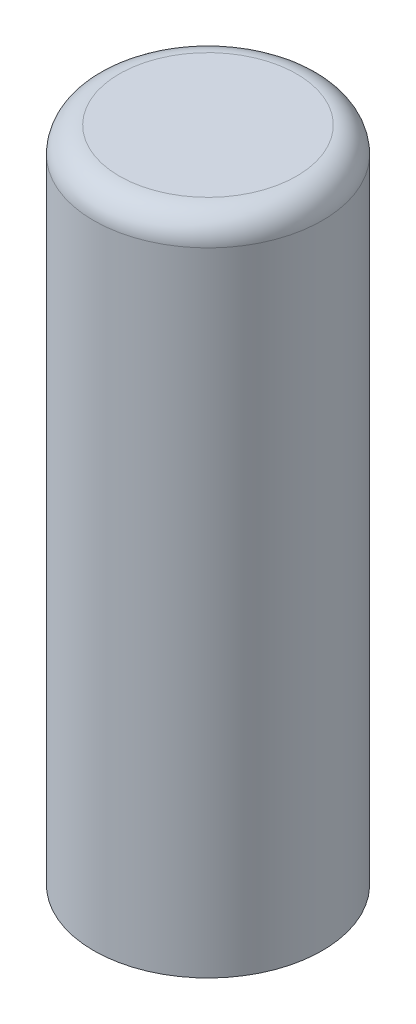
from build123d import *

# Parameters (mm, degrees)
SKETCH1_R           = 15.591175954
BOSS_EXTRUDE1_DEPTH = 71
BOSS_EXTRUDE2_START = 1.25
SKETCH2_R           = 15.591175954
SKETCH2_W           = 17.8
SKETCH2_H           = 1.65
BOSS_EXTRUDE2_DEPTH = 1.25
BOSS_EXTRUDE3_START = 4
SKETCH3_R           = 15.591175954
BOSS_EXTRUDE3_DEPTH = 4
CUT_EXTRUDE4_START  = -11.5
SKETCH16_R          = 0.75
CUT_EXTRUDE4_DEPTH  = 11.5
BOSS_EXTRUDE8_START = 10
SKETCH18_R          = 15.591175954
SKETCH18_R_2        = 13.095738675
BOSS_EXTRUDE8_DEPTH = 10
FILLET3_START       = -12.2500001
FILLET3_OUTLINE_R   = 13.095738675
FILLET3_OUTLINE_R_2 = 0.75
FILLET3_DEPTH       = 7.0000001
FILLET3_START_2     = -11
FILLET3_3_DEPTH     = 5.75
SKETCH26_R          = 15.591175954
BOSS_EXTRUDE9_DEPTH = 3.5
FILLET4_R           = 3.5


with BuildPart() as part:
    # Sketch1 → Boss-Extrude1 (new body)
    with BuildSketch(Plane(origin=(0, 0, 0), x_dir=(1, 0, 0), z_dir=(0, 1, 0))):
        with Locations(Location((0, 0, 0), (0, 0, 270))):
            Circle(SKETCH1_R)
        with BuildLine():
            Line((8.375, -6.964282891), (9.075, -6.964282891))
            Line((9.075, -6.964282891), (9.075, -8.614282891))
            Line((9.075, -8.614282891), (8.375, -8.614282891))
            Line((8.375, -8.614282891), (8.375, -9.610929808))
            ThreePointArc((8.375, -9.610929808), (0, -12.747964417), (-8.375, -9.610929808))
            Line((-8.375, -9.610929808), (-8.375, -8.614282891))
            Line((-8.375, -8.614282891), (-8.725, -8.614282891))
            Line((-8.725, -8.614282891), (-8.725, -6.964282891))
            Line((-8.725, -6.964282891), (-8.375, -6.964282891))
            Line((-8.375, -6.964282891), (-8.375, -6.204282891))
            Line((-8.375, -6.204282891), (-8.375, 9.645717109))
            ThreePointArc((-8.375, 9.645717109), (-7.386485387, 12.032202496), (-5, 13.020717109))
            Line((-5, 13.020717109), (5, 13.020717109))
            ThreePointArc((5, 13.020717109), (7.386485387, 12.032202496), (8.375, 9.645717109))
            Line((8.375, 9.645717109), (8.375, -6.204282891))
            Line((8.375, -6.204282891), (8.375, -6.964282891))
        make_face(mode=Mode.SUBTRACT)
    extrude(amount=BOSS_EXTRUDE1_DEPTH)

    # Sketch2 → Boss-Extrude2 (add)
    with BuildSketch(Plane.XZ.offset(BOSS_EXTRUDE2_START)):
        with Locations(Location((0, 0, 0), (0, 0, 270))):
            Circle(SKETCH2_R)
        with Locations((0.175, 7.789282891)):
            Rectangle(SKETCH2_W, SKETCH2_H, mode=Mode.SUBTRACT)
    extrude(amount=-BOSS_EXTRUDE2_DEPTH)

    # Sketch3 → Boss-Extrude3 (add)
    with BuildSketch(Plane.XZ.offset(1.25).offset(BOSS_EXTRUDE3_START)):
        with Locations(Location((0, 0, 0), (0, 0, 270))):
            Circle(SKETCH3_R)
    extrude(amount=-BOSS_EXTRUDE3_DEPTH)

    # Sketch16 → Cut-Extrude4 (cut)
    with BuildSketch(Plane(origin=(0, 0, 0), x_dir=(1, 0, 0), z_dir=(0, 1, 0)).offset(CUT_EXTRUDE4_START)):
        with BuildLine():
            Line((-3.75, -9.901070776), (-3, -9.901070776))
            Line((-3, -9.901070776), (-2.25, -9.901070776))
            ThreePointArc((-2.25, -9.901070776), (-3, -9.151070776), (-3.75, -9.901070776))
        make_face()
        with BuildLine():
            Line((-2.25, -9.901070776), (-3, -9.901070776))
            Line((-3, -9.901070776), (-3.75, -9.901070776))
            ThreePointArc((-3.75, -9.901070776), (-3, -10.651070776), (-2.25, -9.901070776))
        make_face()
        with BuildLine():
            ThreePointArc((6.75, -9.901070776), (6, -9.151070776), (5.25, -9.901070776))
            ThreePointArc((5.25, -9.901070776), (6, -10.651070776), (6.75, -9.901070776))
        make_face()
        with BuildLine():
            ThreePointArc((3.75, -9.901070776), (3, -9.151070776), (2.25, -9.901070776))
            Line((2.25, -9.901070776), (3, -9.901070776))
            Line((3, -9.901070776), (3.75, -9.901070776))
        make_face()
        with BuildLine():
            Line((3, -9.901070776), (2.25, -9.901070776))
            ThreePointArc((2.25, -9.901070776), (3, -10.651070776), (3.75, -9.901070776))
            Line((3.75, -9.901070776), (3, -9.901070776))
        make_face()
        with BuildLine():
            ThreePointArc((0.75, -9.901070776), (0, -9.151070776), (-0.75, -9.901070776))
            Line((-0.75, -9.901070776), (0, -9.901070776))
            Line((0, -9.901070776), (0.75, -9.901070776))
        make_face()
        with BuildLine():
            Line((0, -9.901070776), (-0.75, -9.901070776))
            ThreePointArc((-0.75, -9.901070776), (0, -10.651070776), (0.75, -9.901070776))
            Line((0.75, -9.901070776), (0, -9.901070776))
        make_face()
        with Locations(Location((-6, -9.901070776, 0), (0, 0, 270))):
            Circle(SKETCH16_R)
        with BuildLine():
            ThreePointArc((5.289192257, -11.598924176), (4.550417773, -10.824582592), (3.789595018, -11.577272013))
            ThreePointArc((3.789595018, -11.577272013), (3.846450326, -11.860961254), (4.006459728, -12.102019552))
            ThreePointArc((4.006459728, -12.102019552), (4.654628095, -11.867815051), (5.289192257, -11.598924176))
        make_face()
        with BuildLine():
            ThreePointArc((2.290136401, -11.577272013), (1.540136401, -10.827272013), (0.790136401, -11.577272013))
            Line((0.790136401, -11.577272013), (1.540136401, -11.577272013))
            Line((1.540136401, -11.577272013), (2.290136401, -11.577272013))
        make_face()
        with BuildLine():
            Line((1.540136401, -11.577272013), (0.790136401, -11.577272013))
            ThreePointArc((0.790136401, -11.577272013), (1.540136401, -12.327272013), (2.290136401, -11.577272013))
            Line((2.290136401, -11.577272013), (1.540136401, -11.577272013))
        make_face()
        with BuildLine():
            ThreePointArc((-0.707561207, -11.577133163), (-2.207561203, -11.577063737), (-0.707561219, -11.577272013))
            ThreePointArc((-0.707561219, -11.577272013), (-0.70756121, -11.577202588), (-0.707561207, -11.577133163))
        make_face()
        with BuildLine():
            ThreePointArc((-5.205190023, -11.636863564), (-4.580517042, -11.896615502), (-3.942943702, -12.122862358))
            ThreePointArc((-3.942943702, -12.122862358), (-4.188076003, -10.877359358), (-5.205190023, -11.636863564))
        make_face()
    extrude(amount=CUT_EXTRUDE4_DEPTH, mode=Mode.SUBTRACT)

    # Sketch18 → Boss-Extrude8 (add)
    with BuildSketch(Plane.XZ.offset(5.25).offset(BOSS_EXTRUDE8_START)):
        with Locations(Location((0, 0, 0), (0, 0, 270))):
            Circle(SKETCH18_R)
        with Locations(Location((0, 0, 0), (0, 0, 270))):
            Circle(SKETCH18_R_2, mode=Mode.SUBTRACT)
    extrude(amount=-BOSS_EXTRUDE8_DEPTH)

    # Fillet3: read off the stored shape, not the designer's step
    # Fillet3 outline → Fillet3 (add)
    with BuildSketch(Plane(origin=(0, 0, 0), x_dir=(1, 0, 0), z_dir=(0, 1, 0)).offset(FILLET3_START)):
        Circle(FILLET3_OUTLINE_R)
        with Locations((-6, -9.901070776)):
            Circle(FILLET3_OUTLINE_R_2, mode=Mode.SUBTRACT)
        with Locations((-1.457561207, -11.577133163)):
            Circle(FILLET3_OUTLINE_R_2, mode=Mode.SUBTRACT)
        with Locations((-3, -9.901070776)):
            Circle(FILLET3_OUTLINE_R_2, mode=Mode.SUBTRACT)
        with Locations((1.540136401, -11.577272013)):
            Circle(FILLET3_OUTLINE_R_2, mode=Mode.SUBTRACT)
        with Locations((0, -9.901070776)):
            Circle(FILLET3_OUTLINE_R_2, mode=Mode.SUBTRACT)
        with Locations((3, -9.901070776)):
            Circle(FILLET3_OUTLINE_R_2, mode=Mode.SUBTRACT)
        with Locations((6, -9.901070776)):
            Circle(FILLET3_OUTLINE_R_2, mode=Mode.SUBTRACT)
    extrude(amount=FILLET3_DEPTH)

    # Fillet3 2 outline → Fillet3 2 (revolve, cut)
    with BuildSketch(Plane.XY):
        with BuildLine():
            Line((6.095738675, -5.25), (0, -5.25))
            Line((0, -5.25), (0, -12.25))
            Line((0, -12.25), (13.095738675, -12.25))
            ThreePointArc((13.095738675, -12.25), (11.045486143, -7.300252532), (6.095738675, -5.25))
        make_face()
    revolve(axis=Axis((0, 0, 0), (0, 1, 0)), mode=Mode.SUBTRACT)

    # Fillet3 3 outline → Fillet3 3 (cut)
    with BuildSketch(Plane(origin=(0, 0, 0), x_dir=(1, 0, 0), z_dir=(0, 1, 0)).offset(FILLET3_START_2)):
        with BuildLine():
            ThreePointArc((4.006459728, -12.102019552), (4.654628094, -11.867815051), (5.289192257, -11.598924176))
            ThreePointArc((5.289192257, -11.598924176), (4.265744538, -10.876286186), (4.006459728, -12.102019552))
        make_face()
        with BuildLine():
            ThreePointArc((-5.205190023, -11.636863564), (-4.580517042, -11.896615502), (-3.942943702, -12.122862358))
            ThreePointArc((-3.942943702, -12.122862358), (-4.188076003, -10.877359358), (-5.205190023, -11.636863564))
        make_face()
    extrude(amount=FILLET3_3_DEPTH, mode=Mode.SUBTRACT)

    # Sketch26 → Boss-Extrude9 (add)
    with BuildSketch(Plane(origin=(0, 71, 0), x_dir=(1, 0, 0), z_dir=(0, 1, 0))):
        with Locations(Location((0, 0, 0), (0, 0, 90))):
            Circle(SKETCH26_R)
    extrude(amount=BOSS_EXTRUDE9_DEPTH)

    # Fillet4
    fillet4_edges = [part.edges().sort_by_distance(p)[0] for p in [
        (0, 74.5, 15.591175954),
    ]]
    fillet(fillet4_edges, radius=FILLET4_R - 0.0001)  # a hair under: the kernel refuses the full size


solid = part.part
